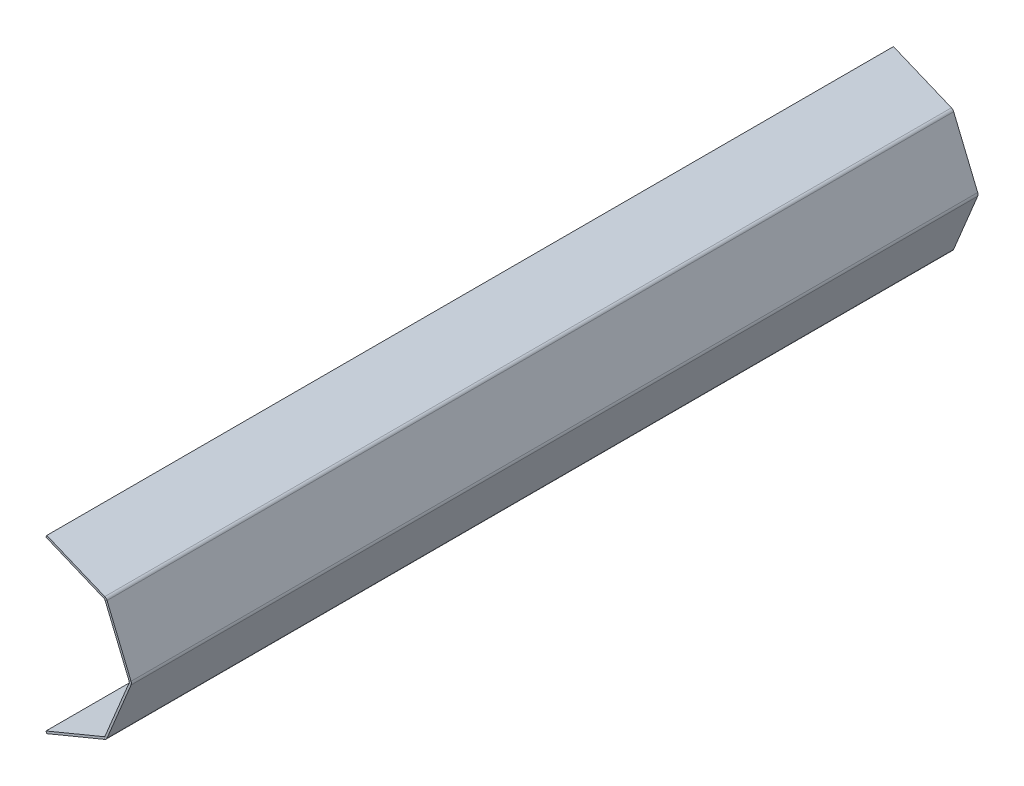
from build123d import *

# Parameters (mm, degrees)
TABAN_FLAN_1_DEPTH = 2010


# Sheet-metal steps are written as plain solids
with BuildPart() as part:
    # Çizim1 → Taban-Flanş1 (new body)
    with BuildSketch(Plane.XY):
        with BuildLine():
            Line((1.913417162, -199.207436661), (139.507939075, -142.213919576))
            ThreePointArc((139.507939075, -142.213919576), (141.13005582, -141.13005582), (142.213919576, -139.507939075))
            Line((142.213919576, -139.507939075), (199.207436661, -1.913417162))
            ThreePointArc((199.207436661, -1.913417162), (199.588038999, 0), (199.207436661, 1.913417162))
            Line((199.207436661, 1.913417162), (142.213919576, 139.507939075))
            ThreePointArc((142.213919576, 139.507939075), (141.13005582, 141.13005582), (139.507939075, 142.213919576))
            Line((139.507939075, 142.213919576), (1.913417162, 199.207436661))
            Line((1.913417162, 199.207436661), (3.826834324, 203.826834324))
            Line((3.826834324, 203.826834324), (141.421356237, 146.833317239))
            ThreePointArc((141.421356237, 146.833317239), (144.665589726, 144.665589726), (146.833317239, 141.421356237))
            Line((146.833317239, 141.421356237), (203.826834324, 3.826834324))
            ThreePointArc((203.826834324, 3.826834324), (204.588038999, 0), (203.826834324, -3.826834324))
            Line((203.826834324, -3.826834324), (146.833317239, -141.421356237))
            ThreePointArc((146.833317239, -141.421356237), (144.665589726, -144.665589726), (141.421356237, -146.833317239))
            Line((141.421356237, -146.833317239), (3.826834324, -203.826834324))
            Line((3.826834324, -203.826834324), (1.913417162, -199.207436661))
        make_face()
    extrude(amount=TABAN_FLAN_1_DEPTH)


solid = part.part
